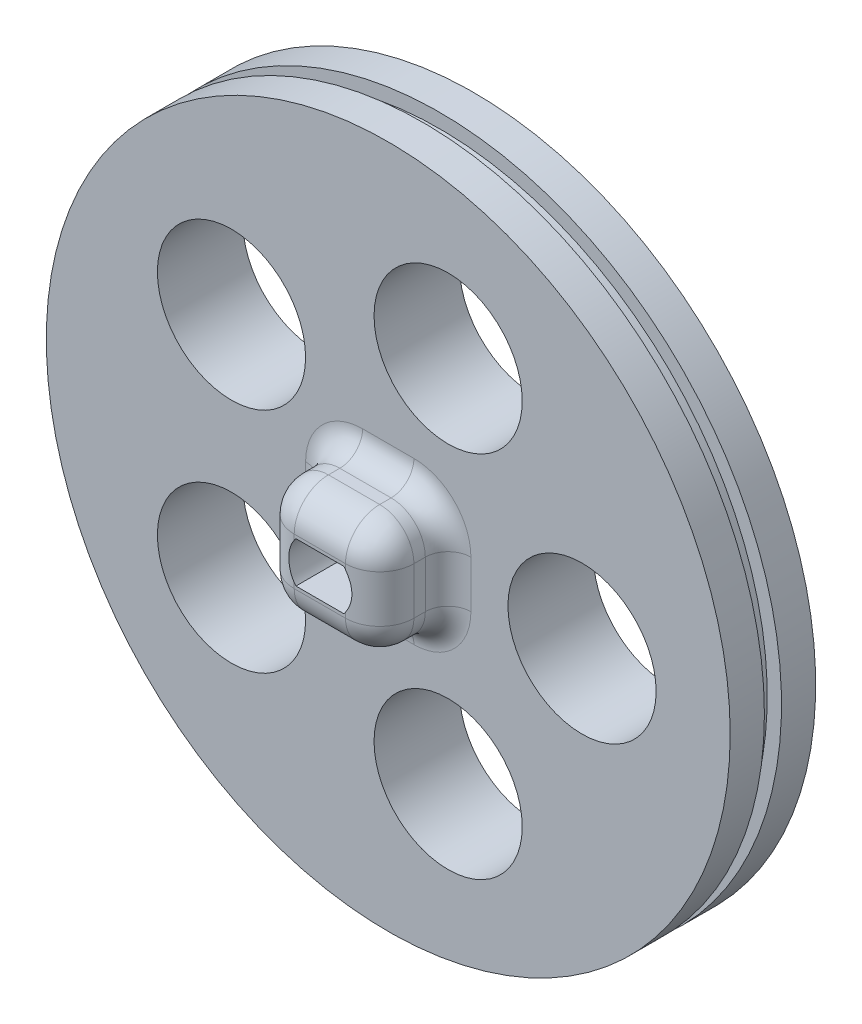
from build123d import *

# Parameters (mm, degrees)
ESQUISSE2_R             = 30
BOSS_EXTRU_1_DEPTH      = 3
ENL_V_MAT_EXTRU_1_DEPTH = 43.532340636
BOSS_EXTRU_3_START      = 6
ESQUISSE5_W             = 10.501413836
ESQUISSE5_H             = 10.144569676
BOSS_EXTRU_3_DEPTH      = 6
ESQUISSE8_R             = 28.75
BOSS_EXTRU_4_DEPTH      = 1.5
BOSS_EXTRU_5_START      = 3
ESQUISSE9_R             = 30
BOSS_EXTRU_5_DEPTH      = 3
ENL_V_MAT_EXTRU_4_DEPTH = 44.370496884
CONG_1_R                = 3
CONG_2_R                = 2
ESQUISSE11_R            = 6.5
AJOURAGE_DEPTH          = 45.522466269


with BuildPart() as part:
    # Esquisse2 → Boss.-Extru.1 (new body)
    with BuildSketch(Plane.XY):
        Circle(ESQUISSE2_R)
    extrude(amount=BOSS_EXTRU_1_DEPTH)

    # Esquisse4 → Enlèv. mat.-Extru.1 (cut, through all)
    with BuildSketch(Plane.XY.offset(3)):
        with BuildLine():
            Line((-2.1, -1.8), (2.1, -1.8))
            ThreePointArc((2.1, -1.8), (2.765863337, 0), (2.1, 1.8))
            Line((2.1, 1.8), (-2.1, 1.8))
            ThreePointArc((-2.1, 1.8), (-2.765863337, 0), (-2.1, -1.8))
        make_face()
    extrude(amount=-ENL_V_MAT_EXTRU_1_DEPTH, mode=Mode.SUBTRACT)

    # Esquisse5 → Boss.-Extru.3 (add)
    with BuildSketch(Plane.XY.offset(3).offset(BOSS_EXTRU_3_START)):
        Rectangle(ESQUISSE5_W, ESQUISSE5_H)
        with BuildLine():
            Line((-2.1, 1.8), (2.1, 1.8))
            ThreePointArc((2.1, 1.8), (2.765863337, 0), (2.1, -1.8))
            Line((2.1, -1.8), (-2.1, -1.8))
            ThreePointArc((-2.1, -1.8), (-2.765863337, 0), (-2.1, 1.8))
        make_face(mode=Mode.SUBTRACT)
    extrude(amount=-BOSS_EXTRU_3_DEPTH)

    # Esquisse8 → Boss.-Extru.4 (add)
    with BuildSketch(Plane(origin=(0, 0, 0), x_dir=(-1, 0, 0), z_dir=(0, 0, -1))):
        Circle(ESQUISSE8_R)
    extrude(amount=BOSS_EXTRU_4_DEPTH)

    # Esquisse9 → Boss.-Extru.5 (add)
    with BuildSketch(Plane(origin=(0, 0, -1.5), x_dir=(-1, 0, 0), z_dir=(0, 0, -1)).offset(BOSS_EXTRU_5_START)):
        with Locations(Location((0, 0, 0), (0, 0, 180))):
            Circle(ESQUISSE9_R)
    extrude(amount=-BOSS_EXTRU_5_DEPTH)

    # Esquisse10 → Enlèv. mat.-Extru.4 (cut, through all)
    with BuildSketch(Plane.XY):
        with BuildLine():
            Line((-2.1, 1.8), (2.1, 1.8))
            ThreePointArc((2.1, 1.8), (2.765863337, 0), (2.1, -1.8))
            Line((2.1, -1.8), (-2.1, -1.8))
            ThreePointArc((-2.1, -1.8), (-2.765863337, 0), (-2.1, 1.8))
        make_face()
    extrude(amount=-ENL_V_MAT_EXTRU_4_DEPTH, mode=Mode.SUBTRACT)

    # Congé1
    # the kernel refuses this fillet: 3 mm, written as the material it takes off along each edge
    with BuildSketch(Plane(origin=(-2.250706918, -2.072284838, 6), x_dir=(-1, 0, 0), z_dir=(0, -1, 0))) as cong_1_piece_1_section:
        Polygon((0, 0), (CONG_1_R, 0), (CONG_1_R, -CONG_1_R), (0, -CONG_1_R), align=None)
    cong_1_piece_1 = extrude(amount=CONG_1_R, mode=Mode.PRIVATE)
    cong_1_piece_1 = cong_1_piece_1 - Plane(origin=(-2.250706918, -2.072284838, 6), x_dir=(0.7071067811865475, 0, -0.7071067811865475), z_dir=(0, -1, 0)) * Sphere(CONG_1_R, mode=Mode.PRIVATE)
    add(cong_1_piece_1, mode=Mode.SUBTRACT)
    with BuildSketch(Plane(origin=(-2.250706918, 2.072284838, 6), x_dir=(-1, 0, 0), z_dir=(0, 1, 0))) as cong_1_piece_2_section:
        Polygon((0, 0), (CONG_1_R, 0), (CONG_1_R, CONG_1_R), (0, CONG_1_R), align=None)
    cong_1_piece_2 = extrude(amount=CONG_1_R, mode=Mode.PRIVATE)
    cong_1_piece_2 = cong_1_piece_2 - Plane(origin=(-2.250706918, 2.072284838, 6), x_dir=(0.7071067811865475, 0, -0.7071067811865475), z_dir=(0, 1, 0)) * Sphere(CONG_1_R, mode=Mode.PRIVATE)
    add(cong_1_piece_2, mode=Mode.SUBTRACT)
    with BuildSketch(Plane(origin=(2.250706918, -2.072284838, 6), x_dir=(0, -1, 0), z_dir=(1, 0, 0))) as cong_1_piece_3_section:
        Polygon((0, 0), (CONG_1_R, 0), (CONG_1_R, -CONG_1_R), (0, -CONG_1_R), align=None)
    cong_1_piece_3 = extrude(amount=CONG_1_R, mode=Mode.PRIVATE)
    cong_1_piece_3 = cong_1_piece_3 - Plane(origin=(2.250706918, -2.072284838, 6), x_dir=(0, 0.7071067811865475, -0.7071067811865475), z_dir=(1, 0, 0)) * Sphere(CONG_1_R, mode=Mode.PRIVATE)
    add(cong_1_piece_3, mode=Mode.SUBTRACT)
    with BuildSketch(Plane(origin=(2.250706918, 2.072284838, 6), x_dir=(1, 0, 0), z_dir=(0, 1, 0))) as cong_1_piece_4_section:
        Polygon((0, 0), (CONG_1_R, 0), (CONG_1_R, -CONG_1_R), (0, -CONG_1_R), align=None)
    cong_1_piece_4 = extrude(amount=CONG_1_R, mode=Mode.PRIVATE)
    cong_1_piece_4 = cong_1_piece_4 - Plane(origin=(2.250706918, 2.072284838, 6), x_dir=(-0.7071067811865475, 0, -0.7071067811865475), z_dir=(0, 1, 0)) * Sphere(CONG_1_R, mode=Mode.PRIVATE)
    add(cong_1_piece_4, mode=Mode.SUBTRACT)
    with BuildSketch(Plane(origin=(-5.250706918, -2.072284838, 9), x_dir=(0, 0, -1), z_dir=(0, 1, 0))) as cong_1_piece_5:
        with BuildLine():
            CenterArc((CONG_1_R, -CONG_1_R), CONG_1_R, 90, 90)
            Line((0, -CONG_1_R), (0, 0))
            Line((0, 0), (CONG_1_R, 0))
        make_face()
    extrude(amount=4.144569676, mode=Mode.SUBTRACT)
    with BuildSketch(Plane(origin=(-5.250706918, 5.072284838, 6), x_dir=(0, -1, 0), z_dir=(0, 0, -1)), Plane(origin=(5.250706918, -5.072284838, 6), x_dir=(0, 1, 0), z_dir=(0, 0, -1)), Plane(origin=(5.250706918, 5.072284838, 6), x_dir=(-1, 0, 0), z_dir=(0, 0, -1))) as cong_1_piece_6:
        with BuildLine():
            CenterArc((CONG_1_R, -CONG_1_R), CONG_1_R, 90, 90)
            Line((0, -CONG_1_R), (0, 0))
            Line((0, 0), (CONG_1_R, 0))
        make_face()
    extrude(amount=3, mode=Mode.SUBTRACT)
    with BuildSketch(Plane(origin=(2.250706918, -5.072284838, 9), x_dir=(0, 1, 0), z_dir=(-1, 0, 0)), Plane(origin=(-2.250706918, 5.072284838, 9), x_dir=(0, -1, 0), z_dir=(1, 0, 0))) as cong_1_piece_7:
        with BuildLine():
            CenterArc((CONG_1_R, CONG_1_R), CONG_1_R, 180, 90)
            Line((0, CONG_1_R), (0, 0))
            Line((0, 0), (CONG_1_R, 0))
        make_face()
    extrude(amount=4.501413836, mode=Mode.SUBTRACT)
    with BuildSketch(Plane(origin=(-5.250706918, -5.072284838, 6), x_dir=(0, 1, 0), z_dir=(0, 0, -1))) as cong_1_piece_8:
        with BuildLine():
            CenterArc((CONG_1_R, CONG_1_R), CONG_1_R, 180, 90)
            Line((0, CONG_1_R), (0, 0))
            Line((0, 0), (CONG_1_R, 0))
        make_face()
    extrude(amount=3, mode=Mode.SUBTRACT)
    with BuildSketch(Plane(origin=(5.250706918, 2.072284838, 9), x_dir=(-1, 0, 0), z_dir=(0, -1, 0))) as cong_1_piece_9:
        with BuildLine():
            CenterArc((CONG_1_R, CONG_1_R), CONG_1_R, 180, 90)
            Line((0, CONG_1_R), (0, 0))
            Line((0, 0), (CONG_1_R, 0))
        make_face()
    extrude(amount=4.144569676, mode=Mode.SUBTRACT)

    # Congé2
    cong_2_edges = [part.edges().sort_by_distance(p)[0] for p in [
        (-5.250706918, 0, 3),
        (0, 5.072284838, 3),
        (0, -5.072284838, 3),
        (5.250706918, 0, 3),
        (-4.372027261, 4.193605182, 3),
        (-4.372027261, -4.193605182, 3),
        (4.372027261, -4.193605182, 3),
        (4.372027261, 4.193605182, 3),
    ]]
    fillet(cong_2_edges, radius=CONG_2_R)

    # Esquisse11 → Ajourage (cut, through all)
    with BuildSketch(Plane(origin=(0, 0, -4.5), x_dir=(-1, 0, 0), z_dir=(0, 0, -1))):
        with Locations((-17, 0)):
            Circle(ESQUISSE11_R)
        with Locations((-5.253288904, 16.167960777)):
            Circle(ESQUISSE11_R)
        with Locations((13.753288904, 9.992349289)):
            Circle(ESQUISSE11_R)
        with Locations((13.753288904, -9.992349289)):
            Circle(ESQUISSE11_R)
        with Locations((-5.253288904, -16.167960777)):
            Circle(ESQUISSE11_R)
    extrude(amount=-AJOURAGE_DEPTH, mode=Mode.SUBTRACT)


solid = part.part
